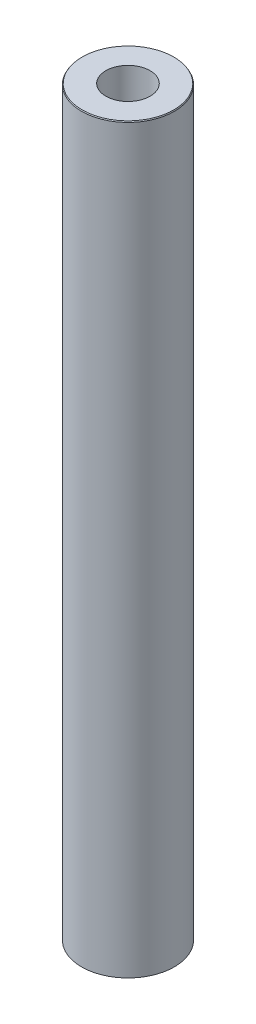
from build123d import *
from OCP.BRepFilletAPI import BRepFilletAPI_MakeChamfer

# Parameters (mm, degrees)
SKETCH1_R           = 37.5
BOSS_EXTRUDE1_DEPTH = 600
SKETCH2_R           = 17.898668844
CUT_EXTRUDE1_DEPTH  = 603.339190158
CHAMFER1_SIZE       = 0.794023577
CHAMFER1_SIZE2      = 0.458429726


with BuildPart() as part:
    # Sketch1 → Boss-Extrude1 (new body)
    with BuildSketch(Plane(origin=(0, 0, 0), x_dir=(1, 0, 0), z_dir=(0, 1, 0))):
        Circle(SKETCH1_R)
    extrude(amount=BOSS_EXTRUDE1_DEPTH)

    # Sketch2 → Cut-Extrude1 (cut, through all)
    with BuildSketch(Plane(origin=(0, 0, 0), x_dir=(1, 0, 0), z_dir=(0, 1, 0))):
        Circle(SKETCH2_R)
    extrude(amount=CUT_EXTRUDE1_DEPTH, mode=Mode.SUBTRACT)

    # Chamfer1: one chamfer whose edges measure the first distance from different faces: ONE call of the kernel's chamfer builder (chamfer() names one face for all edges)
    chamfer1_edges_1 = [part.edges().sort_by_distance(p)[0] for p in [
        (-37.5, 600, 0),
    ]]
    chamfer1_side_1 = [part.faces().sort_by_distance(p)[0] for p in [
        (-37.5, 300, 0),
    ]]
    chamfer1_edges_2 = [part.edges().sort_by_distance(p)[0] for p in [
        (-37.5, 0, 0),
    ]]
    chamfer1_side_2 = [part.faces().sort_by_distance(p)[0] for p in [
        (-36.439339828, 0, 0),
    ]]
    chamfer1 = BRepFilletAPI_MakeChamfer(part.part.solid().wrapped)
    for e in chamfer1_edges_1:
        chamfer1.Add(CHAMFER1_SIZE, CHAMFER1_SIZE2, e.wrapped, chamfer1_side_1[0].wrapped)  # the first distance lies on this face
    for e in chamfer1_edges_2:
        chamfer1.Add(CHAMFER1_SIZE, CHAMFER1_SIZE2, e.wrapped, chamfer1_side_2[0].wrapped)  # the first distance lies on this face
    add(Compound.cast(chamfer1.Shape()), mode=Mode.REPLACE)


solid = part.part
